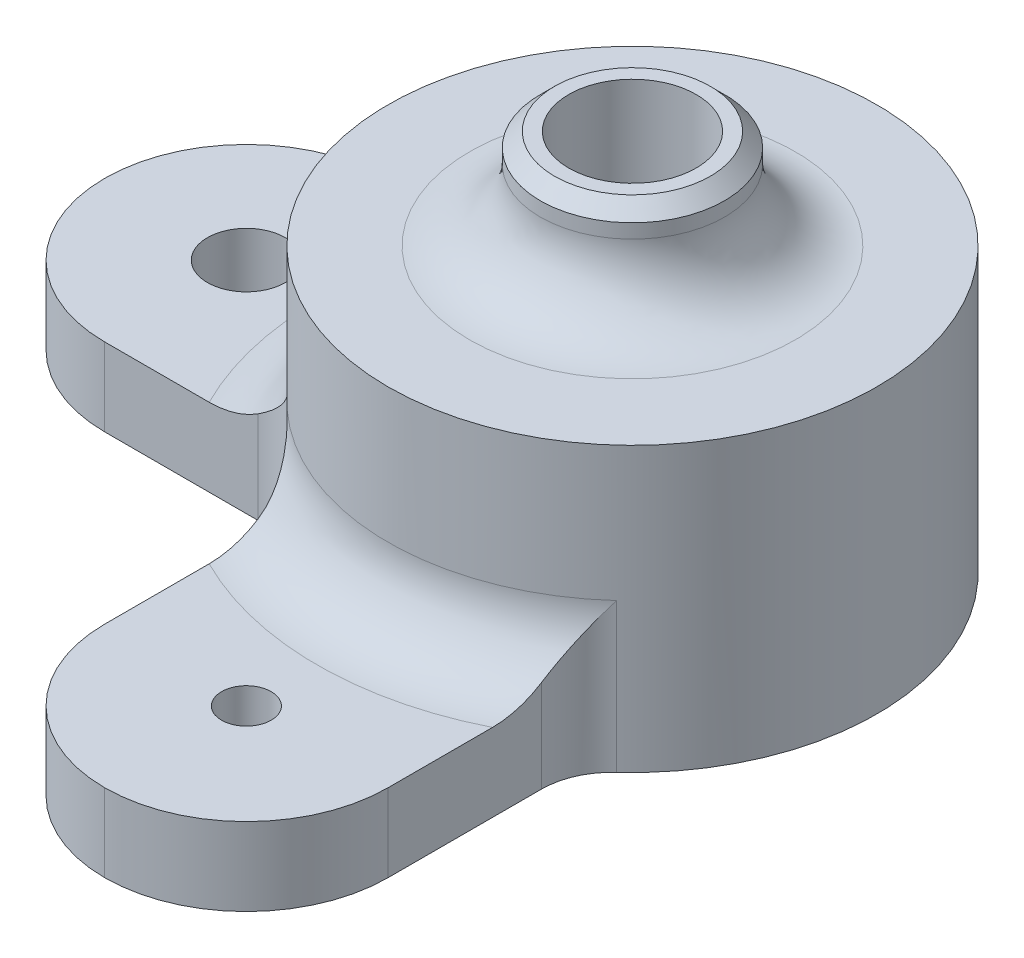
from build123d import *

# Parameters (mm, degrees)
ESBO_O1_R                = 17.25
ESBO_O1_R_2              = 4.5
RESSALTO_EXTRUS_O1_DEPTH = 20
CORTE_EXTRUS_O1_DEPTH    = 8
ESBO_O5_R                = 2.75
ESBO_O5_R_2              = 1.75
RESSALTO_EXTRUS_O2_DEPTH = 5.5
FILETE1_R                = 5
FILETE2_R                = 10
ESBO_O7_R                = 6.5
ESBO_O7_R_2              = 4.5
RESSALTO_EXTRUS_O3_DEPTH = 7
FILETE3_R                = 5
CHANFRO1_SIZE            = 1


with BuildPart() as part:
    # Esboço1 → Ressalto-extrusão1 (new body)
    with BuildSketch(Plane(origin=(0, 0, 0), x_dir=(1, 0, 0), z_dir=(0, 1, 0))):
        with Locations(Location((0, 0, 0), (0, 0, 270))):
            Circle(ESBO_O1_R)
        with Locations(Location((0, 0, 0), (0, 0, 270))):
            Circle(ESBO_O1_R_2, mode=Mode.SUBTRACT)
    extrude(amount=RESSALTO_EXTRUS_O1_DEPTH)

    # Esboço1<3> → Corte-extrusão1 (cut)
    with BuildSketch(Plane(origin=(0, 0, 0), x_dir=(1, 0, 0), z_dir=(0, 1, 0))):
        Polygon((-6.75, 3.897114317), (-6.75, -3.897114317), (0, -7.794228634), (6.75, -3.897114317), (6.75, 3.897114317), (0, 7.794228634), align=None)
    extrude(amount=CORTE_EXTRUS_O1_DEPTH, mode=Mode.SUBTRACT)

    # Esboço5 → Ressalto-extrusão2 (add)
    # profile 1 of 2: a face of its own
    with BuildSketch(Plane.XZ):
        with BuildLine():
            Line((-17.25, 10), (-14.055692797, 10))
            ThreePointArc((-14.055692797, 10), (-17.25, 0), (-14.055692797, -10))
            Line((-14.055692797, -10), (-17.25, -10))
            Line((-17.25, -10), (-37.25, -10))
            Line((-37.25, -10), (-37.25, 10))
            Line((-37.25, 10), (-17.25, 10))
        make_face()
        with Locations(Location((-27.25, 0, 0), (0, 0, 270))):
            Circle(ESBO_O5_R, mode=Mode.SUBTRACT)
    # profile 2 of 2: a face of its own
    with BuildSketch(Plane.XZ):
        with BuildLine():
            Line((-10, 17.25), (-10, 14.055692797))
            ThreePointArc((-10, 14.055692797), (0, 17.25), (10, 14.055692797))
            Line((10, 14.055692797), (10, 17.25))
            Line((10, 17.25), (10, 37.25))
            Line((10, 37.25), (-10, 37.25))
            Line((-10, 37.25), (-10, 17.25))
        make_face()
        with Locations(Location((0, 27.25, 0), (0, 0, 270))):
            Circle(ESBO_O5_R_2, mode=Mode.SUBTRACT)
    extrude(amount=-RESSALTO_EXTRUS_O2_DEPTH)

    # Filete1
    filete1_edges = [part.edges().sort_by_distance(p)[0] for p in [
        (-14.055692797, 2.75, -10),
        (-17.25, 5.5, 0),
        (-14.055692797, 2.75, 10),
        (-5.248895086, 5.5, 16.432029709),
        (10, 2.75, 14.055692797),
        (-10, 2.75, 14.055692797),
    ]]
    fillet(filete1_edges, radius=FILETE1_R)

    # Filete2
    filete2_edges = [part.edges().sort_by_distance(p)[0] for p in [
        (10, 2.75, 37.25),
        (-10, 2.75, 37.25),
        (-37.25, 2.75, -10),
        (-37.25, 2.75, 10),
    ]]
    fillet(filete2_edges, radius=FILETE2_R - 0.0001)  # a hair under: the kernel refuses the full size

    # Esboço7 → Ressalto-extrusão3 (add)
    with BuildSketch(Plane(origin=(0, 20, 0), x_dir=(1, 0, 0), z_dir=(0, 1, 0))):
        with Locations(Location((0, 0, 0), (0, 0, 270))):
            Circle(ESBO_O7_R)
        with Locations(Location((0, 0, 0), (0, 0, 270))):
            Circle(ESBO_O7_R_2, mode=Mode.SUBTRACT)
    extrude(amount=RESSALTO_EXTRUS_O3_DEPTH)

    # Filete3
    filete3_edges = [part.edges().sort_by_distance(p)[0] for p in [
        (0, 20, -6.5),
    ]]
    fillet(filete3_edges, radius=FILETE3_R)

    # Chanfro1
    chanfro1_edges = [part.edges().sort_by_distance(p)[0] for p in [
        (0, 27, -6.5),
    ]]
    chamfer(chanfro1_edges, length=CHANFRO1_SIZE)


solid = part.part
